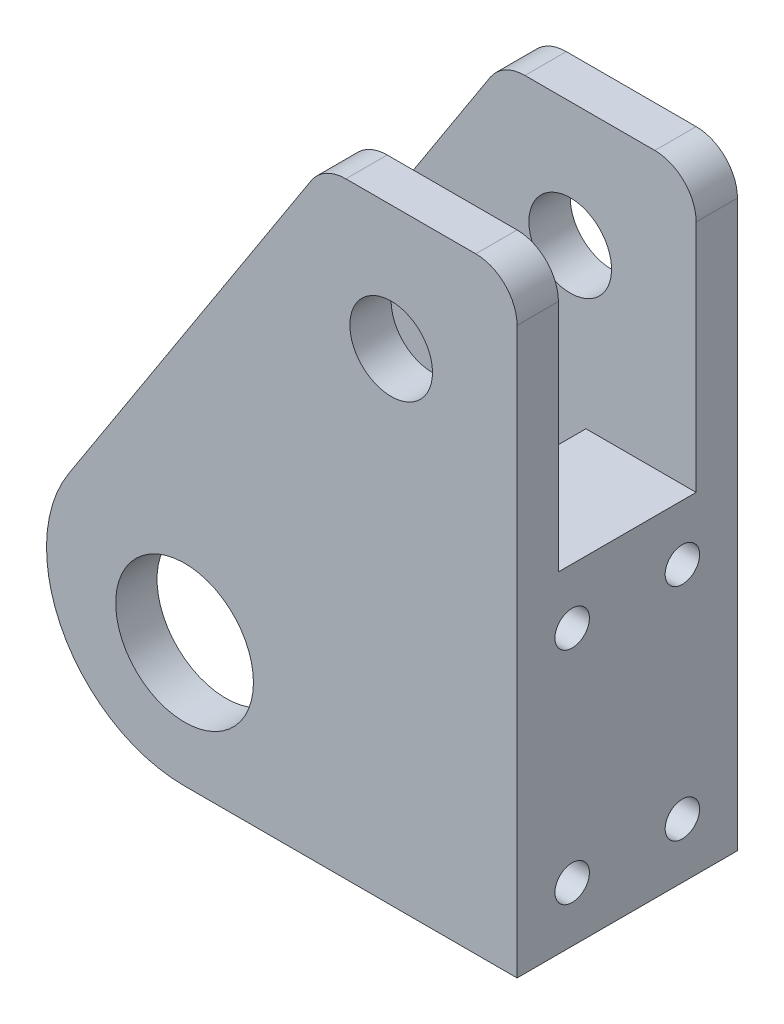
from build123d import *

# Parameters (mm, degrees)
SKETCH_1_R             = 3
EXTRUDE_1_DEPTH        = 2
SKETCH_2_W             = 53.96
SKETCH_2_H             = 15
SKETCH_2_R             = 1.6
SKETCH_2_R_2           = 1
EXTRUDE_2_DEPTH        = 2
PATTERN_LINEAR_1_COUNT = 2
PATTERN_LINEAR_1_PITCH = 13
FILLET_1_R             = 1
EXTRUDE_START          = -16
SKETCH_4_R             = 3
EXTRUDE_3_DEPTH        = 16
SKETCH_5_W             = 71.597299473
SKETCH_5_H             = 10
CUT_EXTRUDE_1_DEPTH    = 15
SKETCH_6_R             = 5
CUT_EXTRUDE_2_DEPTH    = 3
CUT_EXTRUDE_START      = -3
SKETCH_7_R             = 5
CUT_EXTRUDE_3_DEPTH    = 3
FILLET_2_R             = 10
SKETCH_8_W             = 2
SKETCH_8_H             = 0.095117033
EXTRUDE_5_DEPTH        = 0.002
CUT_EXTRUDE_4_DEPTH    = 16
FILLET_3_R             = 3
CUT_EXTRUDE_5_REACH    = 63.416
SKETCH_11_W            = 36.223911337
SKETCH_11_H            = 10
SKETCH_14_W            = 10
SKETCH_14_H            = 20
CUT_EXTRUDE_6_DEPTH    = 8
HOLE_WIZARD_M3_1_D     = 2.5
HOLE_WIZARD_M3_1_DEPTH = 7.5
HOLE_WIZARD_M3_1_TIP   = 0.751075774


with BuildPart() as part:
    # 草图1 → 凸台-拉伸1 (new body)
    with BuildSketch(Plane.XY):
        with BuildLine():
            Line((-31.667580782, -19.712759913), (-15.214545893, -22.177554229))
            Line((-15.214545893, -22.177554229), (-14.362700527, -22.30516738))
            Line((-14.362700527, -22.30516738), (-14.362700527, -23.166518437))
            Line((-14.362700527, -23.166518437), (-14.362700527, -25.01516738))
            Line((-14.362700527, -25.01516738), (39.597299473, -25.01516738))
            Line((39.597299473, -25.01516738), (39.597299473, -20.01516738))
            Line((39.597299473, -20.01516738), (-6.399297664, -20.01516738))
            Line((-6.399297664, -20.01516738), (-6.399297664, 14.684969608))
            ThreePointArc((-6.399297664, 14.684969608), (-6.397869517, 15.219044335), (-6.427963434, 15.752272438))
            ThreePointArc((-6.427963434, 15.752272438), (-6.435285609, 15.800138476), (-6.441446817, 15.848167752))
            ThreePointArc((-6.441446817, 15.848167752), (-13.325191112, 23.766199394), (-23.057324529, 19.846156059))
            Line((-23.057324529, 19.846156059), (-38.645044316, -4.254376507))
            ThreePointArc((-38.645044316, -4.254376507), (-39.369264732, -13.885171984), (-31.667580782, -19.712759913))
        make_face()
        with Locations((-30.439815615, -11.004528038)):
            Circle(SKETCH_1_R, mode=Mode.SUBTRACT)
        with Locations((-15.440178747, 14.976184715)):
            Circle(SKETCH_1_R, mode=Mode.SUBTRACT)
    extrude_1 = extrude(amount=EXTRUDE_1_DEPTH)

    # 草图2 → 凸台-拉伸2 (add)
    with BuildSketch(Plane.XZ.offset(25.01516738)):
        with Locations((12.617299473, -5.5)):
            Rectangle(SKETCH_2_W, SKETCH_2_H)
        with Locations(Location((26.637299473, -5.5, 0), (0, 0, 270))):
            Circle(SKETCH_2_R, mode=Mode.SUBTRACT)
        with Locations(Location((-9.362700527, -5.5, 0), (0, 0, 270))):
            Circle(SKETCH_2_R, mode=Mode.SUBTRACT)
        with Locations(Location((-3.141180602, -5.5, 0), (0, 0, 270))):
            Circle(SKETCH_2_R_2, mode=Mode.SUBTRACT)
        with Locations(Location((20.358819398, -5.5, 0), (0, 0, 270))):
            Circle(SKETCH_2_R_2, mode=Mode.SUBTRACT)
        with BuildLine():
            Line((3.367759388, -1.25), (-1.491180602, -1.25))
            Line((-1.491180602, -1.25), (-1.491180602, -9.75))
            Line((-1.491180602, -9.75), (3.367759388, -9.75))
            ThreePointArc((3.367759388, -9.75), (6.858819398, -11), (10.349879409, -9.75))
            Line((10.349879409, -9.75), (18.708819398, -9.75))
            Line((18.708819398, -9.75), (18.708819398, -1.25))
            Line((18.708819398, -1.25), (10.349879409, -1.25))
            ThreePointArc((10.349879409, -1.25), (6.858819398, 0), (3.367759388, -1.25))
        make_face(mode=Mode.SUBTRACT)
    extrude(amount=-EXTRUDE_2_DEPTH)

    # 阵列(线性)1: 凸台-拉伸1 ×2
    with Locations(*[(0, 0, -i * PATTERN_LINEAR_1_PITCH) for i in range(1, PATTERN_LINEAR_1_COUNT)]):
        add(extrude_1)

    # 圆角1
    fillet_1_edges = [part.edges().sort_by_distance(p)[0] for p in [
        (-14.362700527, -22.30516738, -12),
    ]]
    fillet(fillet_1_edges, radius=FILLET_1_R - 0.0004)  # a hair under: the kernel refuses the full size

    # 草图4 → 凸台-拉伸3 (add)
    with BuildSketch(Plane.XY.offset(2).offset(EXTRUDE_START)):
        Polygon((-20.359667451, 24.017065798), (-48.838793814, -20.01516738), (-6.299297664, -20.01516738), (-6.299297664, 24.017065798), align=None)
        with Locations((-15.440178747, 14.976184715)):
            Circle(SKETCH_4_R, mode=Mode.SUBTRACT)
        with Locations((-30.439815615, -11.004528038)):
            Circle(SKETCH_4_R, mode=Mode.SUBTRACT)
    extrude(amount=EXTRUDE_3_DEPTH)

    # 草图5 → 切除-拉伸1 (cut)
    with BuildSketch(Plane.XY.offset(2)):
        with Locations((3.798649736, -25.01516738)):
            Rectangle(SKETCH_5_W, SKETCH_5_H)
    extrude(amount=-CUT_EXTRUDE_1_DEPTH, mode=Mode.SUBTRACT)

    # 草图6 → 切除-拉伸2 (cut)
    with BuildSketch(Plane.XY.offset(2)):
        with Locations((-30.439815615, -11.004528038)):
            Circle(SKETCH_6_R)
    extrude(amount=-CUT_EXTRUDE_2_DEPTH, mode=Mode.SUBTRACT)

    # 草图7 → 切除-拉伸3 (cut)
    with BuildSketch(Plane(origin=(0, 0, -14), x_dir=(-1, 0, 0), z_dir=(0, 0, -1)).offset(CUT_EXTRUDE_START)):
        with Locations(Location((30.439815615, -11.004528038, 0), (0, 0, 180))):
            Circle(SKETCH_7_R)
    extrude(amount=CUT_EXTRUDE_3_DEPTH, mode=Mode.SUBTRACT)

    # 圆角2
    fillet_2_edges = [part.edges().sort_by_distance(p)[0] for p in [
        (-48.838793814, -20.01516738, -6),
    ]]
    fillet(fillet_2_edges, radius=FILLET_2_R)

    # 草图8 → 凸台-拉伸5 (add)
    with BuildSketch(Plane(origin=(-25.306928561, 16.367991454, 0), x_dir=(0, 0, 1), z_dir=(-0.8396772833764469, 0.5430856836462826, 0))):
        with Locations((-12, 4.189822066)):
            Rectangle(SKETCH_8_W, SKETCH_8_H)
        with Locations((1, 4.189822066)):
            Rectangle(SKETCH_8_W, SKETCH_8_H)
    extrude(amount=EXTRUDE_5_DEPTH)

    # 草图9 → 切除-拉伸4 (cut)
    with BuildSketch(Plane.XY.offset(2)):
        Polygon((-23.00566783, 19.926023671), (-23.057324529, 19.846156059), (-23.897001813, 20.389241743), (-23.845345113, 20.469109355), align=None)
    extrude(amount=-CUT_EXTRUDE_4_DEPTH, mode=Mode.SUBTRACT)

    # 圆角3
    fillet_3_edges = [part.edges().sort_by_distance(p)[0] for p in [
        (-20.359667451, 24.017065798, -6),
        (-6.299297664, 24.017065798, -6),
    ]]
    fillet(fillet_3_edges, radius=FILLET_3_R)

    # 切除-拉伸5: up to this face of the body (flat: up to its plane)
    cut_extrude_5_end = Plane(part.part.faces().sort_by_distance((-18.380481786, -20.01516738, -6))[0])
    # 草图11 → 切除-拉伸5 (cut, up to the picked face)
    with BuildSketch(Plane(origin=(0, 24.017065798, 0), x_dir=(1, 0, 0), z_dir=(0, 1, 0)), mode=Mode.PRIVATE) as cut_extrude_5_sk1:
        with Locations((-32.411253333, 6)):
            Rectangle(SKETCH_11_W, SKETCH_11_H)
    cut_extrude_5_tool1 = split(extrude(cut_extrude_5_sk1.sketch, amount=-CUT_EXTRUDE_5_REACH, mode=Mode.PRIVATE), bisect_by=cut_extrude_5_end, keep=Keep.BOTH, mode=Mode.PRIVATE)
    add(cut_extrude_5_tool1.solids().sort_by(Axis((-32.411253, 24.017066, -6), (0, -1, 0)))[0], mode=Mode.SUBTRACT)

    # 草图14 → 切除-拉伸6 (cut)
    with BuildSketch(Plane.ZY.offset(14.299297664)):
        with Locations((-6, 14.017065798)):
            Rectangle(SKETCH_14_W, SKETCH_14_H)
    extrude(amount=-CUT_EXTRUDE_6_DEPTH, mode=Mode.SUBTRACT)

    # M3 螺纹孔1
    with Locations(Plane(origin=(-6.299297664, 0, 0), x_dir=(0, 0, -1), z_dir=(1, 0, 0))):
        with Locations((2, -0.01516738), (10, -0.01516738), (2, -16.01516738), (10, -16.01516738)):
            Hole(HOLE_WIZARD_M3_1_D / 2, depth=HOLE_WIZARD_M3_1_DEPTH)
            with Locations((0, 0, -(HOLE_WIZARD_M3_1_DEPTH + HOLE_WIZARD_M3_1_TIP / 2))):  # 118° drill point
                Cone(0, HOLE_WIZARD_M3_1_D / 2, HOLE_WIZARD_M3_1_TIP, mode=Mode.SUBTRACT)


solid = part.part
